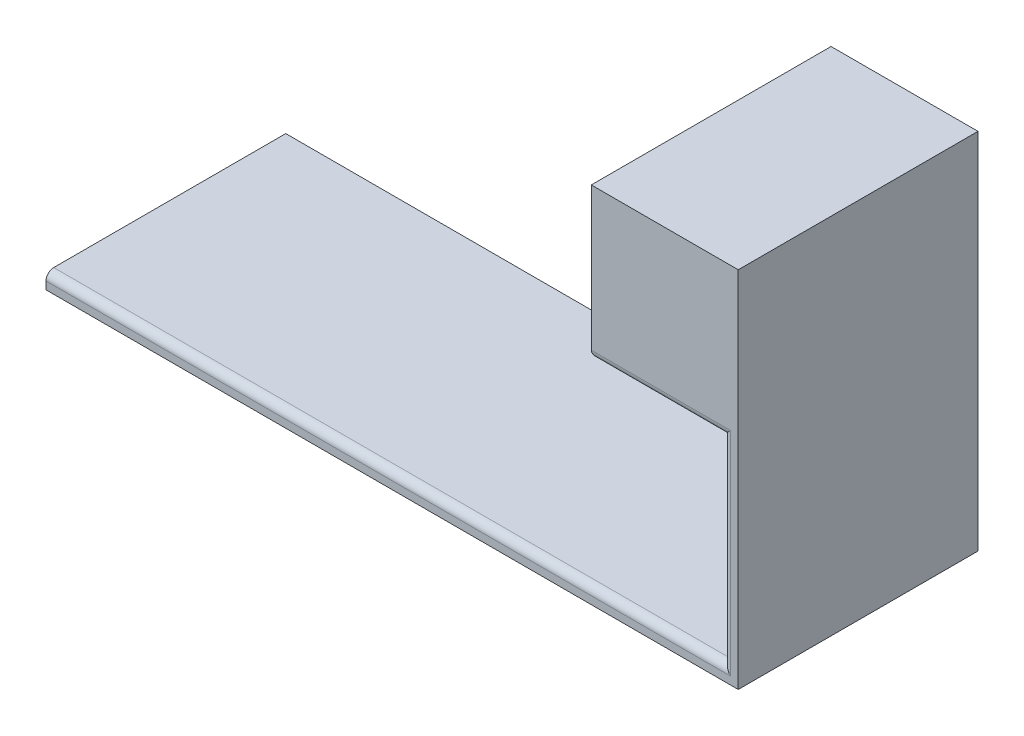
from build123d import *

# Parameters (mm, degrees)
SKETCH1_W           = 38
SKETCH1_H           = 90
BOSS_EXTRUDE1_DEPTH = 62
SKETCH2_W           = 34
SKETCH2_H           = 51
CUT_EXTRUDE1_DEPTH  = 46.8
SKETCH3_W           = 62
SKETCH3_H           = 4
BOSS_EXTRUDE2_DEPTH = 179
SKETCH8_W           = 5
SKETCH8_H           = 30.8
CUT_EXTRUDE4_DEPTH  = 31
SKETCH9_W           = 27
SKETCH9_H           = 13
CUT_EXTRUDE5_DEPTH  = 31
FILLET3_R           = 5
FILLET5_R           = 2
SKETCH11_W          = 8
SKETCH11_H          = 3.9
CUT_EXTRUDE6_DEPTH  = 28


with BuildPart() as part:
    # Sketch1 → Boss-Extrude1 (new body)
    with BuildSketch(Plane.XY):
        with Locations((19, 45)):
            Rectangle(SKETCH1_W, SKETCH1_H)
    extrude(amount=BOSS_EXTRUDE1_DEPTH)

    # Sketch2 → Cut-Extrude1 (cut)
    with BuildSketch(Plane.XY.offset(62)):
        with Locations((17, 25.5)):
            Rectangle(SKETCH2_W, SKETCH2_H)
    extrude(amount=-CUT_EXTRUDE1_DEPTH, mode=Mode.SUBTRACT)

    # Sketch3 → Boss-Extrude2 (add)
    with BuildSketch(Plane(origin=(38, 0, 0), x_dir=(0, 0, -1), z_dir=(1, 0, 0))):
        with Locations((-31, -2)):
            Rectangle(SKETCH3_W, SKETCH3_H)
    extrude(amount=-BOSS_EXTRUDE2_DEPTH)

    # Sketch8 → Cut-Extrude4 (cut)
    with BuildSketch(Plane.ZY):
        with Locations((17.7, 66.4)):
            Rectangle(SKETCH8_W, SKETCH8_H)
    extrude(amount=-CUT_EXTRUDE4_DEPTH, mode=Mode.SUBTRACT)

    # Sketch9 → Cut-Extrude5 (cut)
    with BuildSketch(Plane.XY.offset(15.2)):
        with Locations((13.5, 46.3)):
            Rectangle(SKETCH9_W, SKETCH9_H)
    extrude(amount=-CUT_EXTRUDE5_DEPTH, mode=Mode.SUBTRACT)

    # Fillet3
    fillet3_edges = [part.edges().sort_by_distance(p)[0] for p in [
        (27, 39.8, 7.6),
        (27, 52.8, 7.6),
    ]]
    fillet(fillet3_edges, radius=FILLET3_R)

    # Fillet5
    fillet5_edges = [part.edges().sort_by_distance(p)[0] for p in [
        (-53.5, 0, 62),
        (34, 25.5, 62),
        (17, 51, 62),
        (0, 51, 41.1),
    ]]
    fillet(fillet5_edges, radius=FILLET5_R)

    # Sketch11 → Cut-Extrude6 (cut)
    with BuildSketch(Plane.ZY):
        with Locations((11.2, 1.95)):
            Rectangle(SKETCH11_W, SKETCH11_H)
    extrude(amount=-CUT_EXTRUDE6_DEPTH, mode=Mode.SUBTRACT)


solid = part.part
